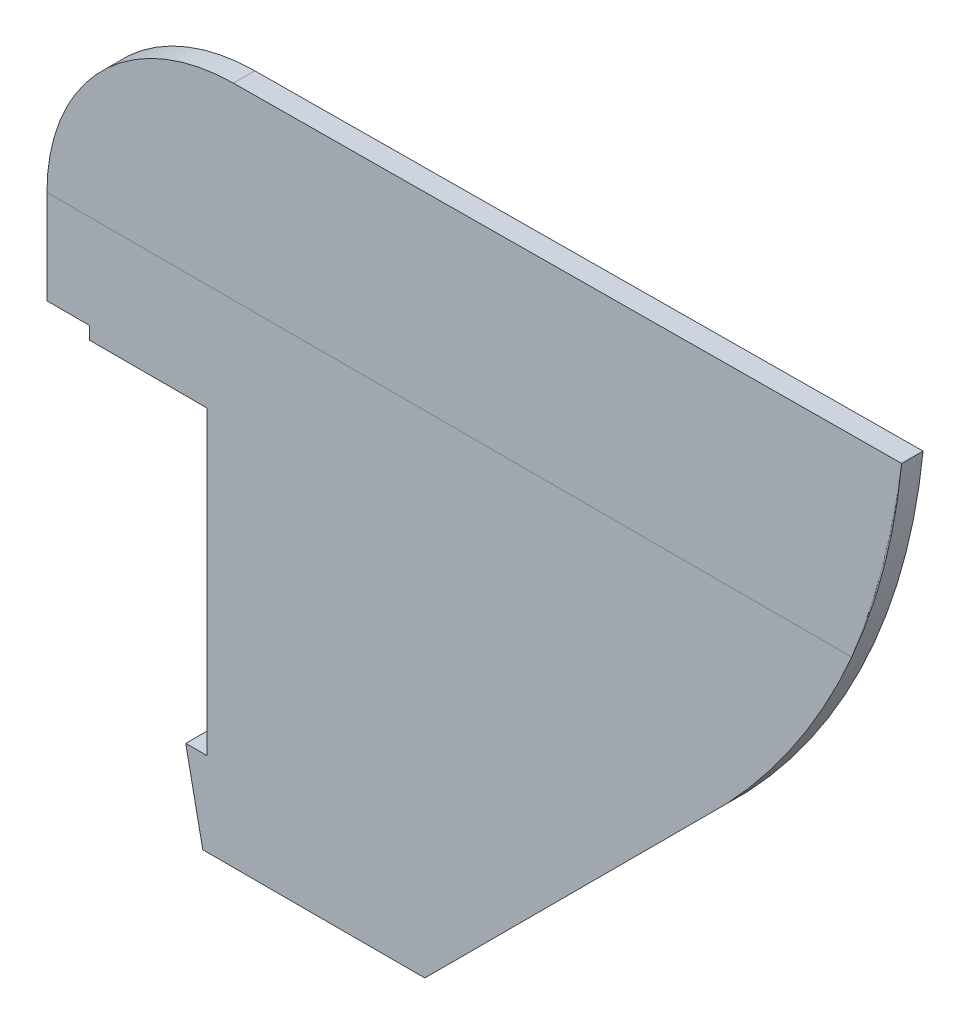
from build123d import *

# Parameters (mm, degrees)
BOSS_EXTRU_1_DEPTH      = 5
BOSS_EXTRU_2_DEPTH      = 0.01
ESQUISSE3_W             = 10
ESQUISSE3_H             = 3
ENL_V_MAT_EXTRU_1_DEPTH = 231.967242256


with BuildPart() as part:
    # Esquisse1 → Boss.-Extru.1 (new body)
    with BuildSketch(Plane.XY):
        with BuildLine():
            Line((0, 0), (0, -25))
            Line((0, -25), (37.5, -25))
            Line((37.5, -25), (37.5, -95.5))
            Line((37.5, -95.5), (32.5, -95.5))
            Line((32.5, -95.5), (36.487358688, -115.098494092))
            Line((36.487358688, -115.098494092), (88.487358688, -115.098494092))
            Line((88.487358688, -115.098494092), (159.198036807, -44.387815974))
            ThreePointArc((159.198036807, -44.387815974), (187.146342861, -3.044299659), (200.182925478, 45.126663235))
            Line((200.182925478, 45.126663235), (43.682925478, 43.998857528))
            ThreePointArc((43.682925478, 43.998857528), (12.775400091, 31.000392909), (0, 0))
        make_face()
    extrude(amount=BOSS_EXTRU_1_DEPTH)

    # Esquisse2 → Boss.-Extru.2 (add)
    with BuildSketch(Plane.XY.offset(5)):
        with BuildLine():
            Line((0, 0), (188.5, 0))
            ThreePointArc((188.5, 0), (195.764398976, 22.194945018), (200.182925478, 45.126663235))
            Line((200.182925478, 45.126663235), (43.682925478, 43.998857528))
            ThreePointArc((43.682925478, 43.998857528), (12.775400091, 31.000392909), (0, 0))
        make_face()
    extrude(amount=BOSS_EXTRU_2_DEPTH)

    # Esquisse3 → Enlèv. mat.-Extru.1 (cut, through all)
    with BuildSketch(Plane.XY.offset(5)):
        with Locations((5, -23.5)):
            Rectangle(ESQUISSE3_W, ESQUISSE3_H)
    extrude(amount=-ENL_V_MAT_EXTRU_1_DEPTH, mode=Mode.SUBTRACT)


solid = part.part
